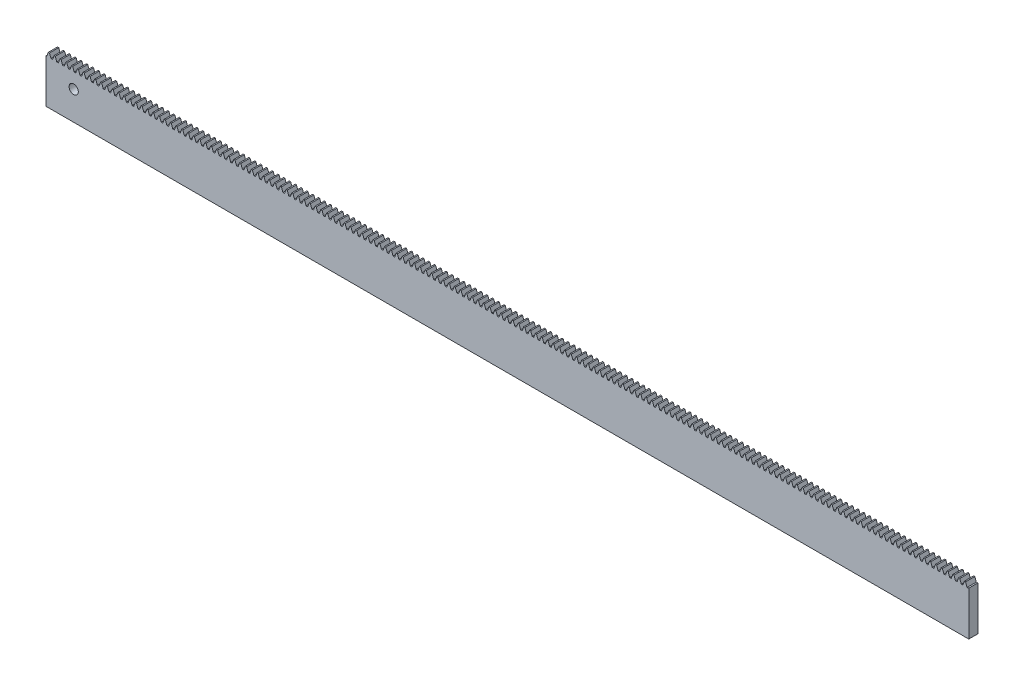
from build123d import *

# Parameters (mm, degrees)
BLANKSKE_W          = 1000
BLANKSKE_H          = 52
BLANK_DEPTH         = 10
TOOTHCUTSIM_DEPTH   = 1002.401018573
TEETHCUTS_COUNT     = 161
TEETHCUTS_PITCH     = 6.2831853
SKETCH_1_R          = 5
CUT_EXTRUDE_1_DEPTH = 1002.401018573


with BuildPart() as part:
    # BlankSke → Blank (new body)
    with BuildSketch(Plane.XY):
        with Locations((500, 26)):
            Rectangle(BLANKSKE_W, BLANKSKE_H)
    extrude(amount=-BLANK_DEPTH)

    # TooCutSkeSim → ToothCutSim (cut, through all)
    with BuildSketch(Plane.XY):
        Polygon((0.861870739, 47.5), (-0.861870739, 47.5), (-2.508981637, 52.0254), (2.508981637, 52.0254), align=None)
    toothcutsim = extrude(amount=-TOOTHCUTSIM_DEPTH, mode=Mode.SUBTRACT)

    # TeethCuts: ToothCutSim ×161
    with Locations(*[(i * TEETHCUTS_PITCH, 0, 0) for i in range(1, TEETHCUTS_COUNT)]):
        add(toothcutsim, mode=Mode.SUBTRACT)

    # Эскиз1 → Вырез-Вытянуть1 (cut, through all)
    with BuildSketch(Plane.XY):
        with Locations((30, 31)):
            Circle(SKETCH_1_R)
    extrude(amount=-CUT_EXTRUDE_1_DEPTH, mode=Mode.SUBTRACT)


solid = part.part
